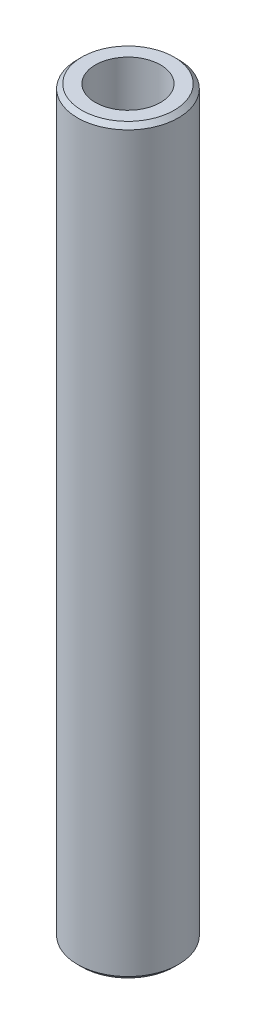
from build123d import *

# Parameters (mm, degrees)
SKETCH1_R           = 37.5
BOSS_EXTRUDE1_DEPTH = 550.941150437
SKETCH2_R           = 24.21604768
CUT_EXTRUDE1_DEPTH  = 554.487715532
CHAMFER1_SIZE       = 3.226229467


with BuildPart() as part:
    # Sketch1 → Boss-Extrude1 (new body)
    with BuildSketch(Plane(origin=(0, 0, 0), x_dir=(1, 0, 0), z_dir=(0, 1, 0))):
        Circle(SKETCH1_R)
    extrude(amount=BOSS_EXTRUDE1_DEPTH)

    # Sketch2 → Cut-Extrude1 (cut, through all)
    with BuildSketch(Plane(origin=(0, 0, 0), x_dir=(1, 0, 0), z_dir=(0, 1, 0))):
        Circle(SKETCH2_R)
    extrude(amount=CUT_EXTRUDE1_DEPTH, mode=Mode.SUBTRACT)

    # Chamfer1
    chamfer1_edges = [part.edges().sort_by_distance(p)[0] for p in [
        (-37.5, 550.941150437, 0),
        (-37.5, 0, 0),
    ]]
    chamfer(chamfer1_edges, length=CHAMFER1_SIZE)


solid = part.part
